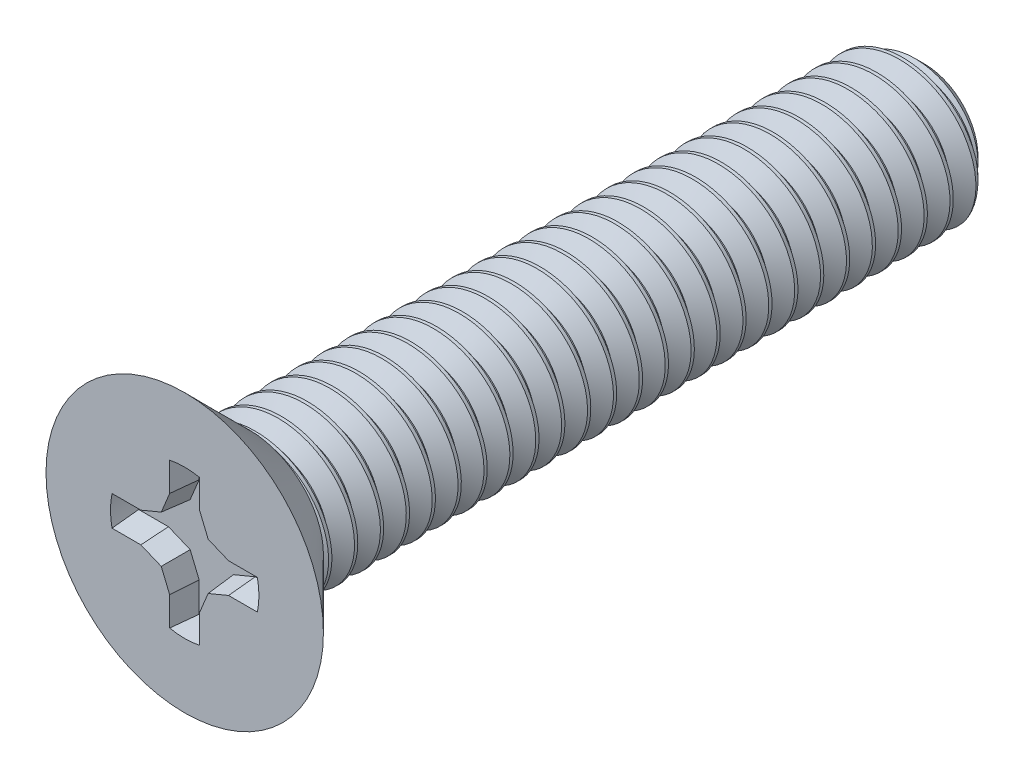
from build123d import *

# Parameters (mm, degrees)
CUT_EXTRUDE1_DEPTH  = 0.733333333
CIRPATTERN1_COUNT   = 4
DRAFT2_ANGLE        = 5
CUT_SWEEP1_PITCH    = 0.7
CUT_SWEEP1_TO       = 18.25
SKETCH8_R           = 2
BOSS_EXTRUDE1_DEPTH = 0.45
BOSS_EXTRUDE1_DRAFT = -45


with BuildPart() as part:
    # Sketch3 → Revolve1 (revolve)
    with BuildSketch(Plane(origin=(0, 0, 0), x_dir=(0, 0, -1), z_dir=(1, 0, 0)), mode=Mode.PRIVATE) as revolve1_sk:
        Polygon((-2.2, 0), (-2.2, 3.75), (-0.45, 2), (-0.45, 0), align=None)
    revolve(revolve1_sk.sketch.rotate(Axis((0, 0, 2.2), (0, 0, -1)), 180), axis=Axis((0, 0, 2.2), (0, 0, -1)))

    # Sketch5 → Revolve2 (revolve)
    with BuildSketch(Plane(origin=(0, 0, 0), x_dir=(0, 0, -1), z_dir=(1, 0, 0))):
        Polygon((17.8, 0), (-0.45, 0), (-0.45, 2), (17.247, 2), (17.8, 1.447), align=None)
    revolve(axis=Axis((0, 0, -17.8), (0, 0, 1)))

    # Sketch4 → Cut-Extrude1 (cut)
    with BuildSketch(Plane.XY.offset(2.2)):
        with BuildLine():
            Line((0, 0), (2.0066, 0))
            ThreePointArc((2.0066, 0), (1.996176592, 0.204261047), (1.965014656, 0.4064))
            Line((1.965014656, 0.4064), (1.185707328, 0.4064))
            Line((1.185707328, 0.4064), (0.634653832, 0.634653832))
            Line((0.634653832, 0.634653832), (0.4064, 1.185707328))
            Line((0.4064, 1.185707328), (0.4064, 1.965014656))
            ThreePointArc((0.4064, 1.965014656), (0.204261047, 1.996176592), (0, 2.0066))
            Line((0, 2.0066), (0, 0))
        make_face()
    cut_extrude1 = extrude(amount=-CUT_EXTRUDE1_DEPTH, mode=Mode.SUBTRACT)

    # CirPattern1: Cut-Extrude1 ×4 about axis
    cirpattern1_axis = Axis((0, 0, 0), (0, 0, 1))
    for i in range(1, CIRPATTERN1_COUNT):
        add(cut_extrude1.rotate(cirpattern1_axis, i * 360 / CIRPATTERN1_COUNT), mode=Mode.SUBTRACT)

    # Draft2
    draft2_faces = [part.faces().sort_by_distance(p)[0] for p in [
        (-1.575360992, 0.4064, 1.833333333),
        (-0.91018058, 0.520526916, 1.833333333),
        (-0.520526916, 0.91018058, 1.833333333),
        (-0.4064, 1.575360992, 1.833333333),
        (0.4064, 1.575360992, 1.833333333),
        (0.520526916, 0.91018058, 1.833333333),
        (0.91018058, 0.520526916, 1.833333333),
        (1.575360992, 0.4064, 1.833333333),
        (1.575360992, -0.4064, 1.833333333),
        (0.91018058, -0.520526916, 1.833333333),
        (0.520526916, -0.91018058, 1.833333333),
        (0.4064, -1.575360992, 1.833333333),
        (-0.4064, -1.575360992, 1.833333333),
        (-0.520526916, -0.91018058, 1.833333333),
        (-0.91018058, -0.520526916, 1.833333333),
        (-1.575360992, -0.4064, 1.833333333),
    ]]
    draft(draft2_faces, Plane(origin=(0, 0, 2.2), x_dir=(0, 1, 0), z_dir=(0, 0, 1)), DRAFT2_ANGLE)


with BuildPart() as body_2:
    # Split1: the piece on the far side of the plane
    add(part.part)
    split(bisect_by=Plane(origin=(0, 0, 0.45), x_dir=(0, -1, 0), z_dir=(0, 0, -1)), keep=Keep.BOTTOM)


with BuildPart() as part_1:
    add(part.part)

    # Split1
    split(bisect_by=Plane(origin=(0, 0, 0.45), x_dir=(0, -1, 0), z_dir=(0, 0, -1)), keep=Keep.TOP)

    # Cut-Sweep1: arcs per turn and ends read off the stored shape
    # Cut-Sweep1: the profile of Sketch7 screwed along a right-hand helix through 28.571429 turns, 6 arcs to a turn; built about Z, then put on its axis
    cut_sweep1_z = Axis((0, 0, 0), (0, 0, 1))
    cut_sweep1_corners = [(1.545336663, 0, -0.35), (1.545336663, 0, -0.2625), (2.037888611, 0, 0.021875), (2.037888611, 0, -0.634375)]
    with BuildLine(mode=Mode.PRIVATE) as cut_sweep1_profile:
        Line(cut_sweep1_corners[0], cut_sweep1_corners[1])
        Line(cut_sweep1_corners[1], cut_sweep1_corners[2])
        Line(cut_sweep1_corners[2], cut_sweep1_corners[3])
        Line(cut_sweep1_corners[3], cut_sweep1_corners[0])
    cut_sweep1_cap = Face(cut_sweep1_profile.wire())
    cut_sweep1_turn_angles = [0, 30, 60, 90, 120, 150, 180, 210, 240, 270, 300, 330, 360]
    cut_sweep1_turn_weights = [1, 0.8660254037844387, 1, 0.8660254037844387, 1, 0.8660254037844387, 1, 0.8660254037844387, 1, 0.8660254037844387, 1, 0.8660254037844387, 1]
    cut_sweep1_turn_rails = [Edge.make_bspline([Vector(p[0], p[1], 0).rotate(cut_sweep1_z, cut_sweep1_turn_angles[k]) / cut_sweep1_turn_weights[k] + Vector(0, 0, p[2] + CUT_SWEEP1_PITCH * cut_sweep1_turn_angles[k] / 360) for k in range(13)], [0, 0, 0, 1, 1, 2, 2, 3, 3, 4, 4, 5, 5, 6, 6, 6], 2, cut_sweep1_turn_weights) for p in cut_sweep1_corners]
    cut_sweep1_turn_sides = [Face.make_surface_from_curves(cut_sweep1_turn_rails[p[0]], cut_sweep1_turn_rails[p[1]]) for p in [(0, 1), (1, 2), (2, 3), (3, 0)]]
    cut_sweep1_last_angles = [10080, 10110, 10140, 10170, 10200, 10230, 10260, 10272.857142857, 10285.714285714]
    cut_sweep1_last_weights = [1, 0.8660254037844387, 1, 0.8660254037844387, 1, 0.8660254037844387, 1, 0.9749279121819003, 1]
    cut_sweep1_last_rails = [Edge.make_bspline([Vector(p[0], p[1], 0).rotate(cut_sweep1_z, cut_sweep1_last_angles[k]) / cut_sweep1_last_weights[k] + Vector(0, 0, p[2] + CUT_SWEEP1_PITCH * cut_sweep1_last_angles[k] / 360) for k in range(9)], [0, 0, 0, 1, 1, 2, 2, 3, 3, 4, 4, 4], 2, cut_sweep1_last_weights) for p in cut_sweep1_corners]
    cut_sweep1_last_sides = [Face.make_surface_from_curves(cut_sweep1_last_rails[p[0]], cut_sweep1_last_rails[p[1]]) for p in [(0, 1), (1, 2), (2, 3), (3, 0)]]
    cut_sweep1 = Plane(origin=(0, 0, -17.8), x_dir=(0, 1, 0), z_dir=(0, 0, 1)) * split(Solid(Shell([*[p.moved(Location((0, 0, CUT_SWEEP1_PITCH * i))) for i in range(28) for p in cut_sweep1_turn_sides], *cut_sweep1_last_sides, cut_sweep1_cap, cut_sweep1_cap.rotate(cut_sweep1_z, 10285.714285714).moved(Location((0, 0, CUT_SWEEP1_PITCH * 10285.714285714 / 360)))])), bisect_by=Plane.XY.offset(CUT_SWEEP1_TO), keep=Keep.BOTTOM, mode=Mode.PRIVATE)
    add(cut_sweep1, mode=Mode.SUBTRACT)


with BuildPart() as body_2_1:
    add(body_2.part)

    # Combine1: union part
    add(part_1.part)


with BuildPart() as boss_extrude1_tool:
    # Sketch8 → Boss-Extrude1 (with draft: the straight prism first)
    with BuildSketch(Plane.XY.offset(0.45)):
        Circle(SKETCH8_R)
    extrude(amount=-BOSS_EXTRUDE1_DEPTH)
    # Boss-Extrude1: the draft: its side faces are tilted about the plane it starts from
    boss_extrude1_sides = [boss_extrude1_tool.faces().sort_by_distance(p)[0] for p in [
        (-2, 0, 0.225),
    ]]
    draft(boss_extrude1_sides, Plane.XY.offset(0.45), BOSS_EXTRUDE1_DRAFT)


with BuildPart() as body_2_2:
    add(body_2_1.part)

    # Boss-Extrude1: add boss_extrude1_tool
    add(boss_extrude1_tool.part)


solid = body_2_2.part
